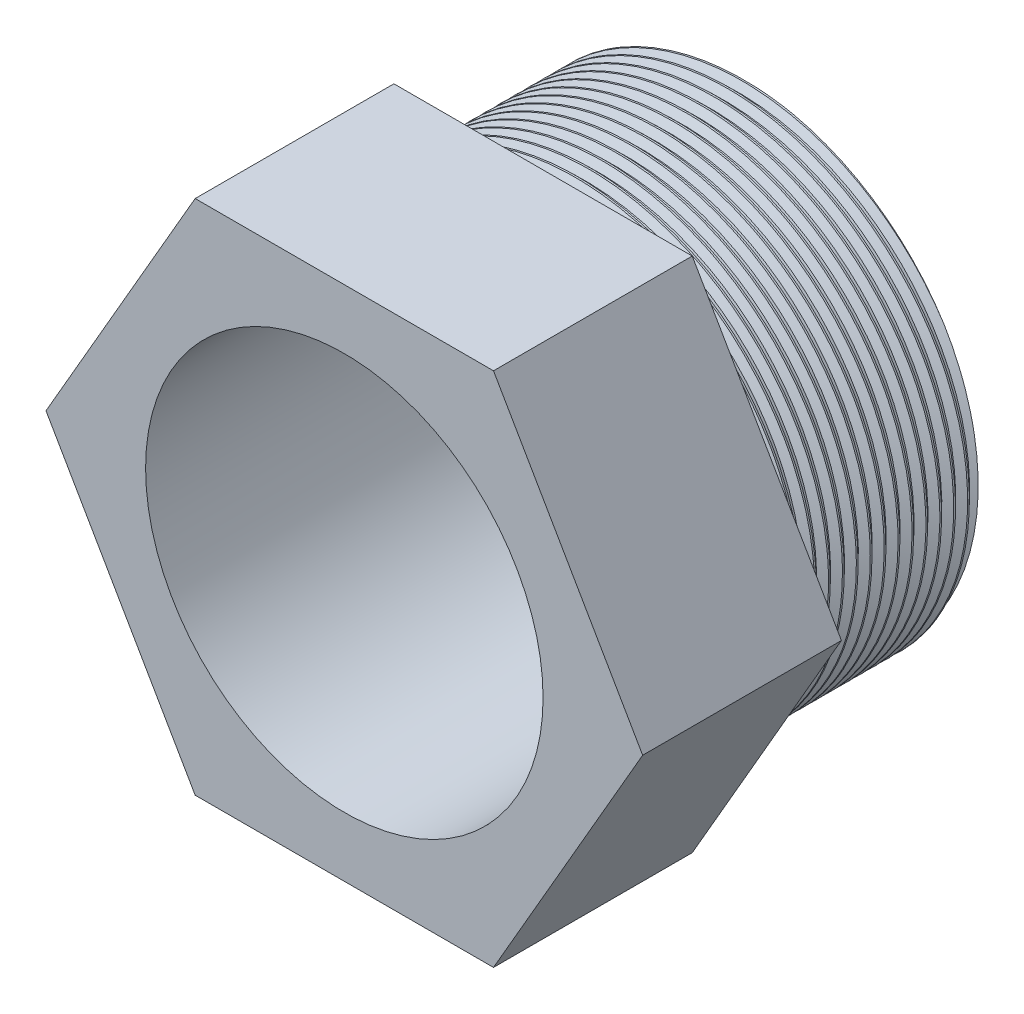
from build123d import *

# Parameters (mm, degrees)
SKETCH1_R           = 6
SKETCH1_R_2         = 5
BOSS_EXTRUDE1_DEPTH = 5
BOSS_EXTRUDE2_START = -5
SKETCH1_3_R         = 6
SKETCH1_3_R_2       = 5
BOSS_EXTRUDE2_DEPTH = 5
THREAD1_PITCH       = 0.35


with BuildPart() as part:
    # Sketch1 → Boss-Extrude1 (new body)
    # profile 1 of 2: a face of its own
    with BuildSketch(Plane.XY):
        Polygon((-7.505553499, 0), (-3.75277675, -6.5), (3.75277675, -6.5), (7.505553499, 0), (3.75277675, 6.5), (-3.75277675, 6.5), align=None)
        Circle(SKETCH1_R, mode=Mode.SUBTRACT)
    # profile 2 of 2: a face of its own
    with BuildSketch(Plane.XY):
        Circle(SKETCH1_R)
        Circle(SKETCH1_R_2, mode=Mode.SUBTRACT)
    extrude(amount=BOSS_EXTRUDE1_DEPTH)

    # Sketch1<3> → Boss-Extrude2 (add)
    with BuildSketch(Plane.XY.offset(BOSS_EXTRUDE2_START)):
        Circle(SKETCH1_3_R)
        Circle(SKETCH1_3_R_2, mode=Mode.SUBTRACT)
    extrude(amount=BOSS_EXTRUDE2_DEPTH)

    # Thread1: the profile of Thread Profile1 profile screwed along a right-hand helix of 14.285714 turns, 6 arcs to a turn; built about Z, then put on its axis
    thread1_z = Axis((0, 0, 0), (0, 0, 1))
    thread1_corners = [(6.0003, 0, -0.000173205), (6.0003, 0, 0.306423204), (5.810556944, 0, 0.196875), (5.810556944, 0, 0.109375)]
    with BuildLine(mode=Mode.PRIVATE) as thread1_profile:
        Line(thread1_corners[0], thread1_corners[1])
        Line(thread1_corners[1], thread1_corners[2])
        Line(thread1_corners[2], thread1_corners[3])
        Line(thread1_corners[3], thread1_corners[0])
    thread1_cap = Face(thread1_profile.wire())
    thread1_turn_angles = [0, 30, 60, 90, 120, 150, 180, 210, 240, 270, 300, 330, 360]
    thread1_turn_weights = [1, 0.8660254037844387, 1, 0.8660254037844387, 1, 0.8660254037844387, 1, 0.8660254037844387, 1, 0.8660254037844387, 1, 0.8660254037844387, 1]
    thread1_turn_rails = [Edge.make_bspline([Vector(p[0], p[1], 0).rotate(thread1_z, thread1_turn_angles[k]) / thread1_turn_weights[k] + Vector(0, 0, p[2] + THREAD1_PITCH * thread1_turn_angles[k] / 360) for k in range(13)], [0, 0, 0, 1, 1, 2, 2, 3, 3, 4, 4, 5, 5, 6, 6, 6], 2, thread1_turn_weights) for p in thread1_corners]
    thread1_turn_sides = [Face.make_surface_from_curves(thread1_turn_rails[p[0]], thread1_turn_rails[p[1]]) for p in [(0, 1), (1, 2), (2, 3), (3, 0)]]
    thread1_last_angles = [5040, 5070, 5100, 5121.428571429, 5142.857142857]
    thread1_last_weights = [1, 0.8660254037844387, 1, 0.9308737486442035, 1]
    thread1_last_rails = [Edge.make_bspline([Vector(p[0], p[1], 0).rotate(thread1_z, thread1_last_angles[k]) / thread1_last_weights[k] + Vector(0, 0, p[2] + THREAD1_PITCH * thread1_last_angles[k] / 360) for k in range(5)], [0, 0, 0, 1, 1, 2, 2, 2], 2, thread1_last_weights) for p in thread1_corners]
    thread1_last_sides = [Face.make_surface_from_curves(thread1_last_rails[p[0]], thread1_last_rails[p[1]]) for p in [(0, 1), (1, 2), (2, 3), (3, 0)]]
    thread1 = Plane(origin=(0, 0, 0), x_dir=(-1, 0, 0), z_dir=(0, 0, -1)) * Solid(Shell([*[p.moved(Location((0, 0, THREAD1_PITCH * i))) for i in range(14) for p in thread1_turn_sides], *thread1_last_sides, thread1_cap, thread1_cap.rotate(thread1_z, 5142.857142857).moved(Location((0, 0, THREAD1_PITCH * 5142.857142857 / 360)))]))
    add(thread1, mode=Mode.SUBTRACT)


solid = part.part
